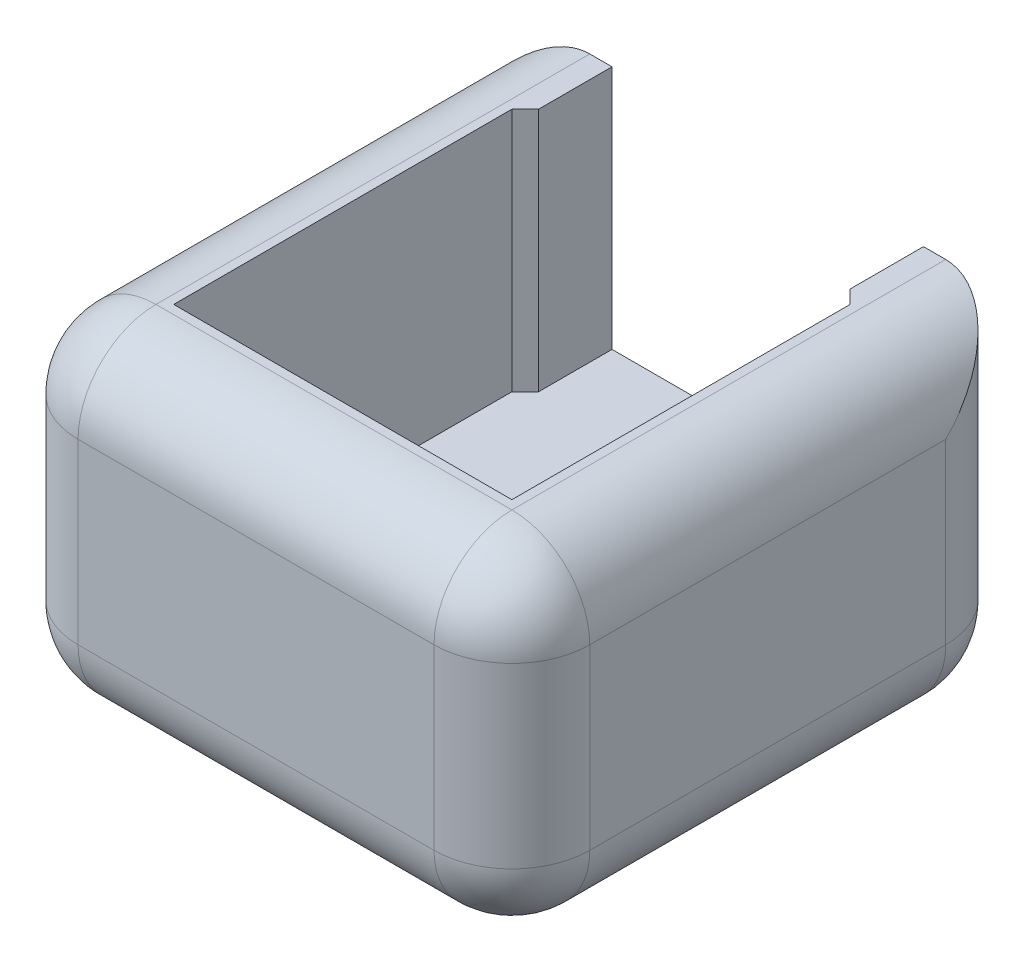
from build123d import *

# Parameters (mm, degrees)
SKETCH_1_W                   = 46
SKETCH_1_H                   = 46
EXTRUDE_1_DEPTH              = 30
SKETCH_2_W                   = 30.4
SKETCH_2_H                   = 30.4
CUT_EXTRUDE_1_DEPTH          = 22
SKETCH_3_W                   = 28
SKETCH_3_H                   = 7.8
CUT_EXTRUDE_2_DEPTH          = 22
FILLET_1_R                   = 7
HOLE_WIZARD_M6_1_D           = 6.2
HOLE_WIZARD_M6_1_CBORE_D     = 11
HOLE_WIZARD_M6_1_CBORE_DEPTH = 5
CHAMFER_1_SIZE               = 1.2


with BuildPart() as part:
    # 草图1 → 凸台-拉伸1 (new body)
    with BuildSketch(Plane(origin=(0, 0, 0), x_dir=(1, 0, 0), z_dir=(0, 1, 0))):
        Rectangle(SKETCH_1_W, SKETCH_1_H)
    extrude(amount=EXTRUDE_1_DEPTH)

    # 草图2 → 切除-拉伸1 (cut)
    with BuildSketch(Plane(origin=(0, 30, 0), x_dir=(1, 0, 0), z_dir=(0, 1, 0))):
        Rectangle(SKETCH_2_W, SKETCH_2_H)
    extrude(amount=-CUT_EXTRUDE_1_DEPTH, mode=Mode.SUBTRACT)

    # 草图3 → 切除-拉伸2 (cut)
    with BuildSketch(Plane(origin=(0, 30, 0), x_dir=(1, 0, 0), z_dir=(0, 1, 0))):
        with Locations((0, 19.1)):
            Rectangle(SKETCH_3_W, SKETCH_3_H)
    extrude(amount=-CUT_EXTRUDE_2_DEPTH, mode=Mode.SUBTRACT)

    # 圆角1
    fillet_1_edges = [part.edges().sort_by_distance(p)[0] for p in [
        (-23, 30, 0),
        (0, 30, 23),
        (23, 30, 0),
        (0, 0, 23),
        (-23, 0, 0),
        (0, 0, -23),
        (23, 0, 0),
        (23, 15, 23),
        (-23, 15, 23),
        (-23, 15, -23),
        (23, 15, -23),
    ]]
    fillet(fillet_1_edges, radius=FILLET_1_R)

    # M6 六角头螺钉的柱形沉头孔1 (through all)
    with Locations(Plane(origin=(0, 0, 0), x_dir=(-1, 0, 0), z_dir=(0, -1, 0))):
        with Locations((0, 0)):
            CounterBoreHole(HOLE_WIZARD_M6_1_D / 2, HOLE_WIZARD_M6_1_CBORE_D / 2, HOLE_WIZARD_M6_1_CBORE_DEPTH)

    # 倒角1
    chamfer_1_edges = [part.edges().sort_by_distance(p)[0] for p in [
        (14, 19, -15.2),
        (-14, 19, -15.2),
    ]]
    chamfer(chamfer_1_edges, length=CHAMFER_1_SIZE - 0.0001)  # a hair under: the kernel refuses the full size


solid = part.part
